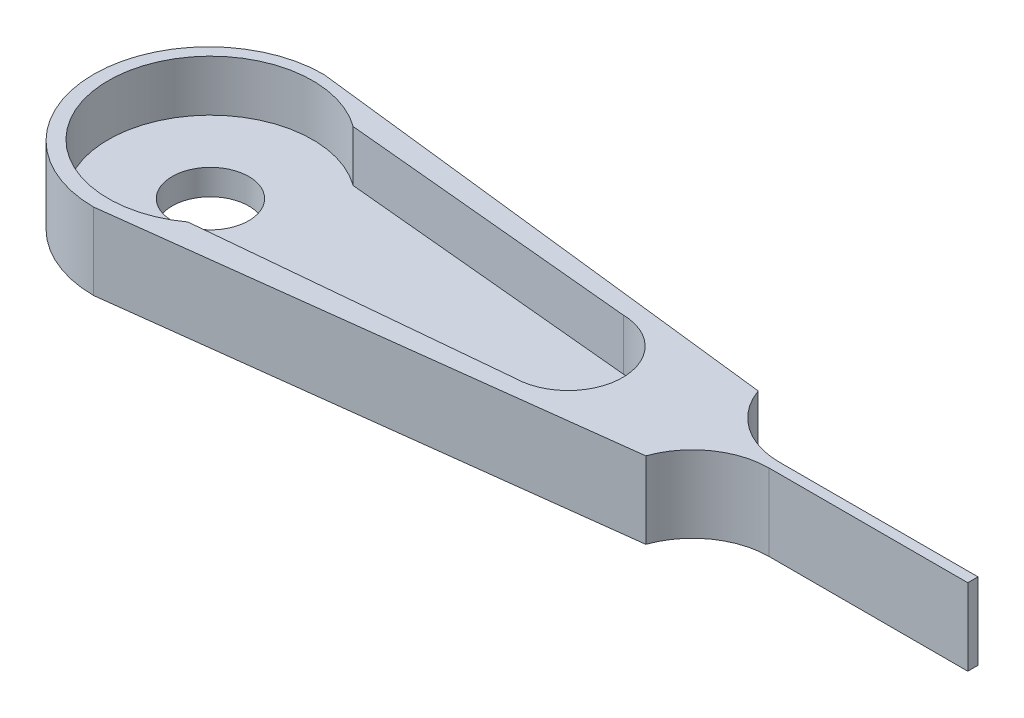
from build123d import *

# Parameters (mm, degrees)
SKETCH2_R           = 1.5
BOSS_EXTRUDE1_DEPTH = 1
BOSS_EXTRUDE2_DEPTH = 3
FILLET1_R           = 3


with BuildPart() as part:
    # Sketch2 → Boss-Extrude1 (new body)
    with BuildSketch(Plane(origin=(0, 0, 0), x_dir=(1, 0, 0), z_dir=(0, 1, 0))):
        with BuildLine():
            Line((-24.633695323, -3.234416395), (-12.961942578, -2.130426094))
            ThreePointArc((-12.961942578, -2.130426094), (-10.856533145, 0), (-12.961942578, 2.130426094))
            Line((-12.961942578, 2.130426094), (-24.633695323, 3.234416395))
            ThreePointArc((-24.633695323, 3.234416395), (-30.987107864, 0), (-24.633695323, -3.234416395))
        make_face()
        with Locations(Location((-26.987107864, 0, 0), (0, 0, 270))):
            Circle(SKETCH2_R, mode=Mode.SUBTRACT)
    extrude(amount=BOSS_EXTRUDE1_DEPTH)

    # Sketch2<3> → Boss-Extrude2 (add)
    with BuildSketch(Plane(origin=(0, 0, 0), x_dir=(1, 0, 0), z_dir=(0, 1, 0))):
        with BuildLine():
            Line((-7.749705802, -2.2), (-7.749705802, -0.2))
            Line((-7.749705802, -0.2), (2.851546862, -0.2))
            Line((2.851546862, -0.2), (2.851546862, 0.2))
            Line((2.851546862, 0.2), (-7.749705802, 0.2))
            Line((-7.749705802, 0.2), (-7.749705802, 2.2))
            Line((-7.749705802, 2.2), (-26.987107864, 4.428352964))
            ThreePointArc((-26.987107864, 4.428352964), (-31.487107864, -0.071647036), (-26.987107864, -4.571647036))
            Line((-26.987107864, -4.571647036), (-7.749705802, -2.2))
        make_face()
        with BuildLine():
            ThreePointArc((-24.633695323, -3.234416395), (-30.987107864, 0), (-24.633695323, 3.234416395))
            Line((-24.633695323, 3.234416395), (-12.961942578, 2.130426094))
            ThreePointArc((-12.961942578, 2.130426094), (-10.856533145, 0), (-12.961942578, -2.130426094))
            Line((-12.961942578, -2.130426094), (-24.633695323, -3.234416395))
        make_face(mode=Mode.SUBTRACT)
    extrude(amount=BOSS_EXTRUDE2_DEPTH)

    # Fillet1
    # the kernel refuses this fillet: 3 mm, written as the material it adds along each edge
    with BuildSketch(Plane(origin=(-7.749705802, 0, 0.2), x_dir=(0, 0, 1), z_dir=(0, 1, 0))) as fillet1_piece_1:
        with BuildLine():
            CenterArc((3, 2.828427125), FILLET1_R, 180, 70.528779366)
            Line((0, 2.828427125), (-0.06, 2.828427125))
            Line((-0.06, 2.828427125), (-0.06, 0))
            Line((-0.06, 0), (0, -0.06))
            ThreePointArc((0, -0.06), (1, -0.06), (1.98, -0.056568542))
            Line((1.98, -0.056568542), (2, 0))
        make_face()
    extrude(amount=3)
    with BuildSketch(Plane(origin=(-7.749705802, 0, -0.2), x_dir=(1, 0, 0), z_dir=(0, 1, 0))) as fillet1_piece_2:
        with BuildLine():
            CenterArc((2.828427125, 3), FILLET1_R, 199.471220634, 70.528779366)
            Line((0, 2), (-0.056568542, 1.98))
            ThreePointArc((-0.056568542, 1.98), (-0.06, 1), (-0.06, 0))
            Line((-0.06, 0), (0, -0.06))
            Line((0, -0.06), (2.828427125, -0.06))
            Line((2.828427125, -0.06), (2.828427125, 0))
        make_face()
    extrude(amount=3)


solid = part.part
